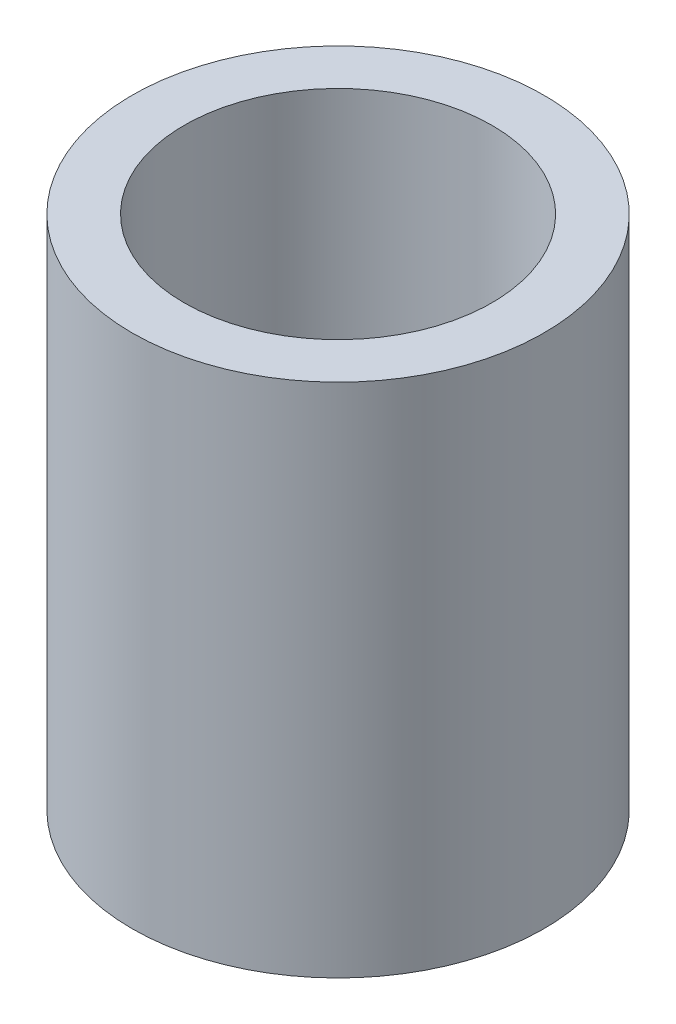
from build123d import *

# Parameters (mm, degrees)
SKETCH1_R           = 15
BOSS_EXTRUDE1_DEPTH = 37.588251217
SKETCH2_R           = 11.206967738
CUT_EXTRUDE1_DEPTH  = 44.161054546


with BuildPart() as part:
    # Sketch1 → Boss-Extrude1 (new body)
    with BuildSketch(Plane(origin=(0, 0, 0), x_dir=(1, 0, 0), z_dir=(0, 1, 0))):
        Circle(SKETCH1_R)
    extrude(amount=BOSS_EXTRUDE1_DEPTH)

    # Sketch2 → Cut-Extrude1 (cut, through all)
    with BuildSketch(Plane(origin=(0, 0, 0), x_dir=(1, 0, 0), z_dir=(0, 1, 0))):
        Circle(SKETCH2_R)
    extrude(amount=CUT_EXTRUDE1_DEPTH, mode=Mode.SUBTRACT)


solid = part.part
